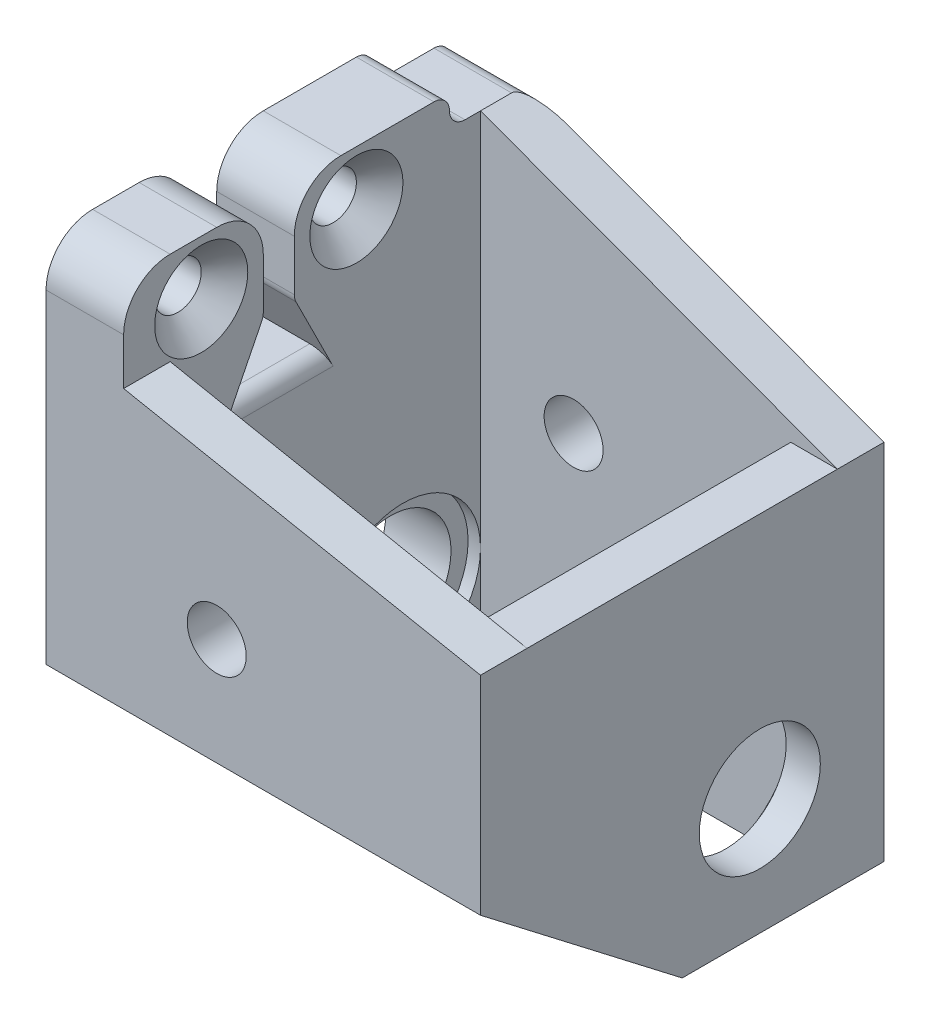
from build123d import *
from build123d.topology import SkipClean

# Parameters (mm, degrees)
SKETCH_1_W                = 20
SKETCH_1_H                = 57.76596942167697
EXTRUDE_1_DEPTH           = 3
EXTRUDE_2_DEPTH           = 3
CUT_EXTRUDE_1_DEPTH       = 6
SKETCH_8_R                = 4.48
CUT_EXTRUDE_2_DEPTH       = 0.8
SKETCH_9_R                = 1.9
CUT_EXTRUDE_3_DEPTH       = 3.8
SKETCH_12_W               = 26.000000000000007
SKETCH_12_H               = 35.36596942167698
CUT_EXTRUDE_4_DEPTH       = 36.00000000000001
CUT_EXTRUDE_8_DEPTH       = 28.00000000000001
SKETCH_23_W               = 26.000000000000004
SKETCH_23_H               = 26
SKETCH_23_W_2             = 20
SKETCH_23_H_2             = 19.999999999999993
EXTRUDE_7_DEPTH           = 4
SKETCH_24_W               = 20
SKETCH_24_H               = 19.999999999999993
EXTRUDE_8_DEPTH           = 3
SKETCH_25_W               = 5.000000000000002
SKETCH_25_H               = 16
SKETCH_25_R               = 1.4999999999999991
EXTRUDE_9_DEPTH           = 3
FILLET_1_R                = 1
CUT_EXTRUDE_9_DEPTH       = 3
SKETCH_27_R               = 1.4999999999999987
CUT_EXTRUDE_10_DEPTH      = 3
SKETCH_28_W               = 20
SKETCH_28_H               = 19.999999999999993
CUT_EXTRUDE_11_DEPTH      = 10
CUT_EXTRUDE_12_DEPTH      = 42.00000000000001
SKETCH_31_R               = 4.48
SKETCH_31_R_2             = 3.98
EXTRUDE_13_DEPTH          = 0.8
SKETCH_32_R               = 5.000000000000001
SKETCH_32_R_2             = 3.98
CUT_EXTRUDE_13_DEPTH      = 0.8
SKETCH_33_R               = 4.48
EXTRUDE_14_DEPTH          = 3
SKETCH_36_R               = 5.000000000000001
CUT_EXTRUDE_14_DEPTH      = 3
SKETCH_37_R               = 3.98
SKETCH_37_R_2             = 3.900000000000001
EXTRUDE_17_DEPTH          = 0.8
SKETCH_38_R               = 1.5000000000000009
EXTRUDE_18_DEPTH          = 3
SKETCH_39_W               = 4.187599959799879
SKETCH_39_H               = 1.3608825238343043
EXTRUDE_19_DEPTH          = 3
EXTRUDE_START             = 2
SKETCH_43_R               = 1.5000000000000024
SKETCH_43_R_2             = 1.5000000000000009
SKETCH_43_R_3             = 3.900000000000002
EXTRUDE_22_DEPTH          = 2
SKETCH_44_W               = 5
SKETCH_44_H               = 9.399224841629362
EXTRUDE_23_DEPTH          = 2
EXTRUDE_24_DEPTH          = 3
SKETCH_47_W               = 5
SKETCH_47_H               = 9.399224841629362
EXTRUDE_25_DEPTH          = 8
SKETCH_51_W               = 5
SKETCH_51_H               = 14
SKETCH_51_H_2             = 7.999999999999998
EXTRUDE_28_DEPTH          = 1.1
CUT_EXTRUDE_16_DEPTH      = 6.1000000000000005
FILLET_START              = -16
FILLET_9_DEPTH            = 7
FILLET_START_2            = -15
FILLET_9_2_DEPTH          = 5
EXTRUDE_30_DEPTH          = 3
FILLET_10_R               = 1
SKETCH_57_W               = 5
SKETCH_57_H               = 10.499224841629362
EXTRUDE_31_DEPTH          = 1
SKETCH_58_W               = 5
SKETCH_58_H               = 10.499224841629362
EXTRUDE_32_DEPTH          = 1
FILLET_11_R               = 3
CUT_EXTRUDE_19_DEPTH      = 6.500000000000001
FILLET_14_R               = 1
FILLET_19_R               = 1
HOLE_WIZARD_1_D           = 3
HOLE_WIZARD_1_DEPTH       = 5
HOLE_WIZARD_1_CSINK_D     = 6
HOLE_WIZARD_1_CSINK_ANGLE = 90


with BuildPart() as part:
    # 草图1 → 凸台-拉伸1 (new body)
    with BuildSketch(Plane.XY):
        with Locations((0, -28.882984710838485)):
            Rectangle(SKETCH_1_W, SKETCH_1_H)
    extrude_1 = extrude(amount=-EXTRUDE_1_DEPTH)

    # 草图2 → 凸台-拉伸2 (add)
    with BuildSketch(Plane.ZY.offset(10)):
        Polygon((-3, -1.22e-15), (23, 0), (23.000000000000007, -57.76596942167697), (-3, -57.76596942167697), align=None)
    extrude_2 = extrude(amount=EXTRUDE_2_DEPTH)

    # 草图7 → 切除-拉伸1 (cut)
    with BuildSketch(Plane(origin=(-10, 0, 0), x_dir=(0, 0, -1), z_dir=(1, 0, 0))):
        with BuildLine():
            ThreePointArc((-1.0999999999999996, -14.899999999999997), (-5, -10.999999999999996), (-8.9, -14.899999999999997))
            Line((-8.9, -14.899999999999997), (-1.1000000000000014, -14.899999999999997))
        make_face()
        with BuildLine():
            Line((-1.1000000000000014, -14.899999999999997), (-8.9, -14.899999999999997))
            ThreePointArc((-8.9, -14.899999999999997), (-5.000000000000001, -18.799999999999997), (-1.0999999999999996, -14.899999999999999))
        make_face()
    cut_extrude_1 = extrude(amount=-CUT_EXTRUDE_1_DEPTH, mode=Mode.SUBTRACT)

    # 草图8 → 切除-拉伸2 (cut)
    with BuildSketch(Plane.ZY.offset(13.000000000000002)):
        with Locations((5, -14.899999999999997)):
            Circle(SKETCH_8_R)
    cut_extrude_2 = extrude(amount=-CUT_EXTRUDE_2_DEPTH, mode=Mode.SUBTRACT)

    # 草图9 → 切除-拉伸3 (cut)
    with BuildSketch(Plane.XY):
        with Locations((-4, -5.499999999999998)):
            Circle(SKETCH_9_R)
    cut_extrude_3 = extrude(amount=-CUT_EXTRUDE_3_DEPTH, mode=Mode.SUBTRACT)

    # 镜向1: 凸台-拉伸2 across plane
    add(extrude_2.mirror(Plane(origin=(0, 0, 0), x_dir=(0, 0, 1), z_dir=(1, 0, 0))))

    # 镜向2: 切除-拉伸1, 切除-拉伸2 across plane
    add(cut_extrude_1.mirror(Plane(origin=(0, 0, 0), x_dir=(0, 0, 1), z_dir=(1, 0, 0))), mode=Mode.SUBTRACT)
    add(cut_extrude_2.mirror(Plane(origin=(0, 0, 0), x_dir=(0, 0, 1), z_dir=(1, 0, 0))), mode=Mode.SUBTRACT)

    # 镜向3: 凸台-拉伸1 across plane
    add(extrude_1.mirror(Plane.XY.offset(10)))

    # 镜向5: 切除-拉伸3 across plane
    add(cut_extrude_3.mirror(Plane.XY.offset(10)), mode=Mode.SUBTRACT)

    # 草图12 → 切除-拉伸4 (cut)
    with BuildSketch(Plane(origin=(13.000000000000002, 0, 0), x_dir=(0, 0, -1), z_dir=(1, 0, 0))):
        with Locations((-10.000000000000004, -40.08298471083848)):
            Rectangle(SKETCH_12_W, SKETCH_12_H)
    extrude(amount=-CUT_EXTRUDE_4_DEPTH, mode=Mode.SUBTRACT)

    # 草图22 → 切除-拉伸8 (cut)
    with BuildSketch(Plane(origin=(13.000000000000002, 0, 0), x_dir=(0, 0, -1), z_dir=(1, 0, 0))):
        Polygon((-23.000000000000007, -12.399999999999997), (-23.000000000000007, -22.399999999999995), (-10.000000000000007, -22.399999999999995), align=None)
    extrude(amount=-CUT_EXTRUDE_8_DEPTH, mode=Mode.SUBTRACT)

    # 草图23 → 凸台-拉伸7 (add)
    with BuildSketch(Plane(origin=(0, 0, 0), x_dir=(1, 0, 0), z_dir=(0, 1, 0))):
        with Locations((0, -10)):
            Rectangle(SKETCH_23_W, SKETCH_23_H)
        with Locations((0, -9.999999999999996)):
            Rectangle(SKETCH_23_W_2, SKETCH_23_H_2, mode=Mode.SUBTRACT)
    extrude(amount=EXTRUDE_7_DEPTH)

    # 草图24 → 凸台-拉伸8 (add)
    with BuildSketch(Plane(origin=(0, 4, 0), x_dir=(1, 0, 0), z_dir=(0, 1, 0))):
        with Locations((0, -9.999999999999996)):
            Rectangle(SKETCH_24_W, SKETCH_24_H)
    extrude(amount=-EXTRUDE_8_DEPTH)

    # 草图25 → 凸台-拉伸9 (add)
    with BuildSketch(Plane(origin=(0, 4, 0), x_dir=(1, 0, 0), z_dir=(0, 1, 0))):
        with Locations((15.500000000000004, -15)):
            Rectangle(SKETCH_25_W, SKETCH_25_H)
        with Locations(Location((15.500000000000002, -20.23329325648959, 0), (0, 0, 270))):
            Circle(SKETCH_25_R, mode=Mode.SUBTRACT)
        with Locations(Location((15.500000000000002, -10.23329325648959, 0), (0, 0, 270))):
            Circle(SKETCH_25_R, mode=Mode.SUBTRACT)
    extrude(amount=-EXTRUDE_9_DEPTH)

    # 圆角1
    fillet_1_edges = [part.edges().sort_by_distance(p)[0] for p in [
        (18.000000000000004, 1, 15),
    ]]
    fillet(fillet_1_edges, radius=FILLET_1_R)

    # 草图26 → 切除-拉伸9 (cut)
    with BuildSketch(Plane(origin=(13.000000000000002, 0, 0), x_dir=(0, 0, -1), z_dir=(1, 0, 0))):
        with BuildLine():
            Line((-16, 1.0000000000000004), (-13.999999999999998, 1.0000000000000004))
            ThreePointArc((-13.999999999999998, 1.0000000000000004), (-15, 0), (-16, 1.0000000000000004))
        make_face()
    extrude(amount=-CUT_EXTRUDE_9_DEPTH, mode=Mode.SUBTRACT)

    # 草图27 → 切除-拉伸10 (cut)
    with BuildSketch(Plane(origin=(0, 4, 0), x_dir=(1, 0, 0), z_dir=(0, 1, 0))):
        with Locations(Location((7.500000000000002, -15.233293256489592, 0), (0, 0, 270))):
            Circle(SKETCH_27_R)
    extrude(amount=-CUT_EXTRUDE_10_DEPTH, mode=Mode.SUBTRACT)

    # 草图28 → 切除-拉伸11 (cut)
    with BuildSketch(Plane.XZ.offset(-1)):
        with Locations((0, 9.999999999999996)):
            Rectangle(SKETCH_28_W, SKETCH_28_H)
    extrude(amount=-CUT_EXTRUDE_11_DEPTH, mode=Mode.SUBTRACT)

    # 草图29 → 切除-拉伸12 (cut)
    with BuildSketch(Plane(origin=(0, 0, -3), x_dir=(-1, 0, 0), z_dir=(0, 0, -1))):
        Polygon((13.000000000000002, 4), (-24.68163228941081, 4), (-24.68163228941081, 0.9999999999999957), (13.000000000000002, 1.0000000000000002), align=None)
    extrude(amount=-CUT_EXTRUDE_12_DEPTH, mode=Mode.SUBTRACT)

    # 草图31 → 凸台-拉伸13 (add)
    with BuildSketch(Plane.ZY.offset(12.200000000000001)):
        with Locations((5, -14.899999999999997)):
            Circle(SKETCH_31_R)
        with Locations((5, -14.899999999999997)):
            Circle(SKETCH_31_R_2, mode=Mode.SUBTRACT)
    extrude(amount=EXTRUDE_13_DEPTH)

    # 草图32 → 切除-拉伸13 (cut)
    with BuildSketch(Plane(origin=(-10, 0, 0), x_dir=(0, 0, -1), z_dir=(1, 0, 0))):
        with Locations((-5, -14.899999999999997)):
            Circle(SKETCH_32_R)
        with Locations(Location((-5, -14.899999999999997, 0), (0, 0, 180))):
            Circle(SKETCH_32_R_2, mode=Mode.SUBTRACT)
    cut_extrude_13 = extrude(amount=-CUT_EXTRUDE_13_DEPTH, mode=Mode.SUBTRACT)

    # 草图33 → 凸台-拉伸14 (add)
    with BuildSketch(Plane(origin=(13.000000000000002, 0, 0), x_dir=(0, 0, -1), z_dir=(1, 0, 0))):
        with Locations((-5, -14.899999999999997)):
            Circle(SKETCH_33_R)
    extrude(amount=-EXTRUDE_14_DEPTH)

    # 镜向6: 切除-拉伸1, 切除-拉伸13 across plane
    add(cut_extrude_1.mirror(Plane(origin=(0, 0, 0), x_dir=(0, 0, 1), z_dir=(1, 0, 0))), mode=Mode.SUBTRACT)
    add(cut_extrude_13.mirror(Plane(origin=(0, 0, 0), x_dir=(0, 0, 1), z_dir=(1, 0, 0))), mode=Mode.SUBTRACT)

    # 草图36 → 切除-拉伸14 (cut)
    with BuildSketch(Plane(origin=(-10.8, 0, 0), x_dir=(0, 0, -1), z_dir=(1, 0, 0))):
        with Locations((-5, -14.899999999999997)):
            Circle(SKETCH_36_R)
    cut_extrude_14 = extrude(amount=CUT_EXTRUDE_14_DEPTH, mode=Mode.SUBTRACT)

    # 镜向7: 切除-拉伸14 across plane
    add(cut_extrude_14.mirror(Plane(origin=(0, 0, 0), x_dir=(0, 0, 1), z_dir=(1, 0, 0))), mode=Mode.SUBTRACT)

    # 草图37 → 凸台-拉伸17 (add)
    with SkipClean():  # the faces are left unmerged after this step: merging them gives an invalid solid
        with BuildSketch(Plane.ZY.offset(12.200000000000001)):
            with Locations((5, -14.899999999999997)):
                Circle(SKETCH_37_R)
            with Locations((5, -14.899999999999997)):
                Circle(SKETCH_37_R_2, mode=Mode.SUBTRACT)
        extrude(amount=EXTRUDE_17_DEPTH)

    # 草图38 → 凸台-拉伸18 (add)
    # profile 1 of 2: a face of its own
    with SkipClean():  # the faces are left unmerged after this step: merging them gives an invalid solid
        with BuildSketch(Plane.ZY.offset(13.000000000000002)):
            Polygon((15, 10.399224841629362), (15, 1), (20.999999999999996, 1.0000000000000002), (20.999999999999996, 10.399224841629362), align=None)
            with Locations((18, 8)):
                Circle(SKETCH_38_R, mode=Mode.SUBTRACT)
        # profile 2 of 2: a face of its own
        with BuildSketch(Plane.ZY.offset(13.000000000000002)):
            Polygon((11, 1), (11, 10.399224841629362), (5.000000000000001, 10.399224841629362), (5.000000000000001, 1.0000000000000002), align=None)
            with Locations((8, 8)):
                Circle(SKETCH_38_R, mode=Mode.SUBTRACT)
        extrude(amount=-EXTRUDE_18_DEPTH)

    # 草图39 → 凸台-拉伸19 (add)
    with SkipClean():  # the faces are left unmerged after this step: merging them gives an invalid solid
        with BuildSketch(Plane(origin=(13.000000000000002, 0, 0), x_dir=(0, 0, -1), z_dir=(1, 0, 0))):
            with Locations((-15.28799119011226, 0.3195587380828476)):
                Rectangle(SKETCH_39_W, SKETCH_39_H)
        extrude(amount=-EXTRUDE_19_DEPTH)

    # 草图43 → 凸台-拉伸22 (add)
    with BuildSketch(Plane.ZY.offset(13.000000000000002).offset(EXTRUDE_START)):
        Polygon((-3, 1.0000000000000002), (5.000000000000004, 1.0000000000000002), (5.000000000000001, 10.399224841629362), (11, 10.399224841629362), (11, 1.0000000000000002), (15, 1.0000000000000002), (15, 10.399224841629362), (20.999999999999996, 10.399224841629362), (20.999999999999996, 1.0000000000000002), (23.000000000000007, 1.0000000000000002), (23.000000000000007, -12.399999999999997), (10.000000000000009, -22.399999999999995), (-3, -22.399999999999995), align=None)
        with Locations((8, 8)):
            Circle(SKETCH_43_R, mode=Mode.SUBTRACT)
        with Locations((18, 8)):
            Circle(SKETCH_43_R_2, mode=Mode.SUBTRACT)
        with Locations((5, -14.899999999999997)):
            Circle(SKETCH_43_R_3, mode=Mode.SUBTRACT)
    extrude(amount=-EXTRUDE_22_DEPTH)

    # 草图44 → 凸台-拉伸23 (add)
    with BuildSketch(Plane.XY.offset(20.999999999999996)):
        with Locations((-12.500000000000002, 5.699612420814681)):
            Rectangle(SKETCH_44_W, SKETCH_44_H)
    extrude(amount=EXTRUDE_23_DEPTH)

    # 草图45 → 凸台-拉伸24 (add)
    with BuildSketch(Plane.XY.offset(23)):
        Polygon((-10.000000000000002, 0.9999999999999981), (13.000000000000002, 0.9999999999999943), (-10.000000000000002, 5.499999999999998), align=None)
    extrude(amount=-EXTRUDE_24_DEPTH)

    # 草图47 → 凸台-拉伸25 (add)
    with BuildSketch(Plane(origin=(0, 0, 5.000000000000001), x_dir=(-1, 0, 0), z_dir=(0, 0, -1))):
        with Locations((12.500000000000002, 5.699612420814681)):
            Rectangle(SKETCH_47_W, SKETCH_47_H)
    extrude(amount=EXTRUDE_25_DEPTH)

    # 草图51 → 凸台-拉伸28 (add)
    with BuildSketch(Plane(origin=(0, 10.399224841629362, 0), x_dir=(1, 0, 0), z_dir=(0, 1, 0))):
        with Locations((-12.500000000000002, -4)):
            Rectangle(SKETCH_51_W, SKETCH_51_H)
        with Locations((-12.500000000000002, -19)):
            Rectangle(SKETCH_51_W, SKETCH_51_H_2)
    extrude(amount=EXTRUDE_28_DEPTH)

    # 草图53 → 切除-拉伸16 (cut)
    with BuildSketch(Plane(origin=(-10, 0, 0), x_dir=(0, 0, -1), z_dir=(1, 0, 0))):
        Polygon((2.999999999999999, 11.499224841629362), (-2.000000000000001, 11.499224841629362), (-2.0000000000000004, 9.49922484162936), (2.999999999999999, 9.499224841629362), align=None)
    extrude(amount=-CUT_EXTRUDE_16_DEPTH, mode=Mode.SUBTRACT)

    # 圆角9: read off the stored shape, not the designer's step
    # 圆角9 outline → 圆角9 (cut)
    with BuildSketch(Plane.YZ.offset(FILLET_START)):
        with BuildLine():
            Line((11.499224842, 2), (11.499224842, 3))
            ThreePointArc((11.499224842, 3), (11.206331623, 2.292893219), (10.499224842, 2))
            Line((10.499224842, 2), (11.499224842, 2))
        make_face()
    extrude(amount=FILLET_9_DEPTH, mode=Mode.SUBTRACT)

    # Fillet 9 2 outline → Fillet 9 2 (add)
    with BuildSketch(Plane.YZ.offset(FILLET_START_2)):
        with BuildLine():
            ThreePointArc((9.499224842, 1), (9.79211806, 1.707106782), (10.499224842, 2))
            Line((10.499224842, 2), (9.499224842, 2))
            Line((9.499224842, 2), (9.499224842, 1))
        make_face()
    extrude(amount=FILLET_9_2_DEPTH)

    # 草图54 → 凸台-拉伸30 (add)
    with BuildSketch(Plane(origin=(0, 0, -3), x_dir=(-1, 0, 0), z_dir=(0, 0, -1))):
        Polygon((-13.000000000000002, 0.9999999999999972), (10.000000000000002, 1.0000000000000002), (10, 9.499224841629362), align=None)
    extrude(amount=-EXTRUDE_30_DEPTH)

    # 圆角10
    fillet_10_edges = [part.edges().sort_by_distance(p)[0] for p in [
        (-12.5, 9.499224841629362, -2.999999999999999),
    ]]
    fillet(fillet_10_edges, radius=FILLET_10_R)

    # 草图57 → 凸台-拉伸31 (add)
    with BuildSketch(Plane(origin=(0, 0, 15), x_dir=(-1, 0, 0), z_dir=(0, 0, -1))):
        with Locations((12.500000000000002, 6.249612420814681)):
            Rectangle(SKETCH_57_W, SKETCH_57_H)
    extrude(amount=EXTRUDE_31_DEPTH)

    # 草图58 → 凸台-拉伸32 (add)
    with BuildSketch(Plane.XY.offset(11)):
        with Locations((-12.500000000000002, 6.249612420814681)):
            Rectangle(SKETCH_58_W, SKETCH_58_H)
    extrude(amount=EXTRUDE_32_DEPTH)

    # 圆角11
    # the kernel refuses this fillet: 3 mm, written as the material it takes off along each edge
    with BuildSketch(Plane(origin=(-2.5000000000000018, 11.499224841629362, 23), x_dir=(0, -1, 0), z_dir=(-1, 0, 0)), Plane(origin=(-2.5000000000000018, 11.499224841629362, 14), x_dir=(0, 0, 1), z_dir=(-1, 0, 0))) as fillet_11_piece_1:
        with BuildLine():
            CenterArc((FILLET_11_R, -FILLET_11_R), FILLET_11_R, 90, 90)
            Line((0, -FILLET_11_R), (0, 0))
            Line((0, 0), (FILLET_11_R, 0))
        make_face()
    extrude(amount=20, mode=Mode.SUBTRACT)
    with BuildSketch(Plane(origin=(-22.5, 11.499224841629362, 12), x_dir=(0, -1, 0), z_dir=(1, 0, 0))) as fillet_11_piece_2:
        with BuildLine():
            CenterArc((FILLET_11_R, FILLET_11_R), FILLET_11_R, 180, 90)
            Line((0, FILLET_11_R), (0, 0))
            Line((0, 0), (FILLET_11_R, 0))
        make_face()
    extrude(amount=20, mode=Mode.SUBTRACT)

    # 草图61 → 切除-拉伸19 (cut)
    with BuildSketch(Plane(origin=(-10, 0, 0), x_dir=(0, 0, -1), z_dir=(1, 0, 0))):
        Polygon((-12, 1.0000000000000002), (-12, 5), (-10, 1.0000000000000007), align=None)
        Polygon((-13.999999999999998, 1.0000000000000002), (-13.999999999999998, 5), (-16, 0.9999999999999998), align=None)
    extrude(amount=-CUT_EXTRUDE_19_DEPTH, mode=Mode.SUBTRACT)

    # 圆角14
    fillet_14_edges = [part.edges().sort_by_distance(p)[0] for p in [
        (-10, 1.0000000000000002, 13),
    ]]
    fillet(fillet_14_edges, radius=FILLET_14_R)

    # 圆角19
    fillet_19_edges = [part.edges().sort_by_distance(p)[0] for p in [
        (-12.5, 5, 12),
        (-12.5, 5, 13.999999999999998),
    ]]
    fillet(fillet_19_edges, radius=FILLET_19_R)

    # 打孔尺寸(%根据)内六角花形沉头螺钉的类型1
    with Locations(Plane(origin=(-10, 8, 18), x_dir=(0, 0, 1), z_dir=(1, 0, 0))):
        with Locations((0, 0), (-10, 0)):
            CounterSinkHole(HOLE_WIZARD_1_D / 2, HOLE_WIZARD_1_CSINK_D / 2, depth=HOLE_WIZARD_1_DEPTH, counter_sink_angle=HOLE_WIZARD_1_CSINK_ANGLE)


solid = part.part
